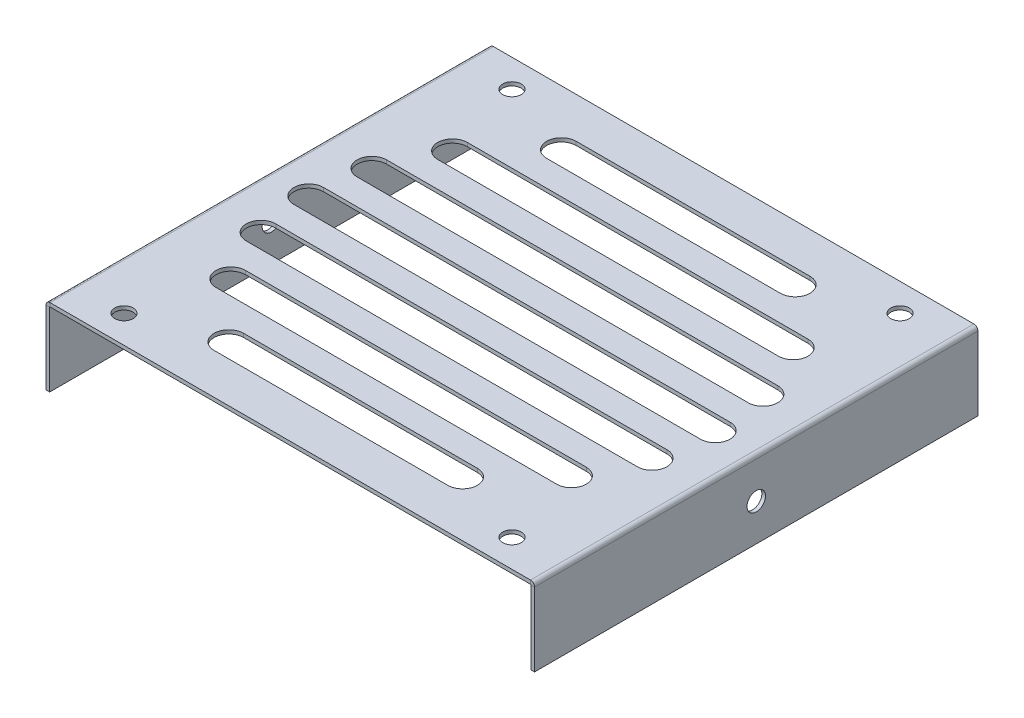
from build123d import *

# Parameters (mm, degrees)
SKETCH1_W               = 130
SKETCH1_H               = 120
SKETCH1_R               = 2.5
BOSS_EXTRUDE1_DEPTH     = 1
EDGE_FLANGE1_DEPTH      = 120
CUT_EXTRUDE1_DEPTH      = 92.48338647
CUT_EXTRUDE1_DEPTH_BACK = 92.48338647
SKETCH10_R              = 2.5


# Sheet-metal steps are written as plain solids
with BuildPart() as part:
    # Sketch1 → Boss-Extrude1 (new body)
    with BuildSketch(Plane(origin=(0, 0, 0), x_dir=(1, 0, 0), z_dir=(0, 1, 0))):
        Rectangle(SKETCH1_W, SKETCH1_H)
        with Locations(Location((-52.5, 52.5, 0), (0, 0, 270))):
            Circle(SKETCH1_R, mode=Mode.SUBTRACT)
        with Locations(Location((52.5, 52.5, 0), (0, 0, 90))):
            Circle(SKETCH1_R, mode=Mode.SUBTRACT)
        with Locations(Location((52.5, -52.5, 0), (0, 0, 270))):
            Circle(SKETCH1_R, mode=Mode.SUBTRACT)
        with Locations(Location((-52.5, -52.5, 0), (0, 0, 90))):
            Circle(SKETCH1_R, mode=Mode.SUBTRACT)
        with BuildLine():
            Line((-31.622776602, 49), (31.622776602, 49))
            ThreePointArc((31.622776602, 49), (35.622776602, 45), (31.622776602, 41))
            Line((31.622776602, 41), (-31.622776602, 41))
            ThreePointArc((-31.622776602, 41), (-35.622776602, 45), (-31.622776602, 49))
        make_face(mode=Mode.SUBTRACT)
        with BuildLine():
            Line((-46.097722286, 34), (46.097722286, 34))
            ThreePointArc((46.097722286, 34), (50.097722286, 30), (46.097722286, 26))
            Line((46.097722286, 26), (-46.097722286, 26))
            ThreePointArc((-46.097722286, 26), (-50.097722286, 30), (-46.097722286, 34))
        make_face(mode=Mode.SUBTRACT)
        with BuildLine():
            Line((-52.915026221, 19), (52.915026221, 19))
            ThreePointArc((52.915026221, 19), (56.915026221, 15), (52.915026221, 11))
            Line((52.915026221, 11), (-52.915026221, 11))
            ThreePointArc((-52.915026221, 11), (-56.915026221, 15), (-52.915026221, 19))
        make_face(mode=Mode.SUBTRACT)
        with BuildLine():
            Line((-55, 4), (55, 4))
            ThreePointArc((55, 4), (59, 0), (55, -4))
            Line((55, -4), (-55, -4))
            ThreePointArc((-55, -4), (-59, 0), (-55, 4))
        make_face(mode=Mode.SUBTRACT)
        with BuildLine():
            Line((-52.915026221, -19), (52.915026221, -19))
            ThreePointArc((52.915026221, -19), (56.915026221, -15), (52.915026221, -11))
            Line((52.915026221, -11), (-52.915026221, -11))
            ThreePointArc((-52.915026221, -11), (-56.915026221, -15), (-52.915026221, -19))
        make_face(mode=Mode.SUBTRACT)
        with BuildLine():
            Line((-46.097722286, -34), (46.097722286, -34))
            ThreePointArc((46.097722286, -34), (50.097722286, -30), (46.097722286, -26))
            Line((46.097722286, -26), (-46.097722286, -26))
            ThreePointArc((-46.097722286, -26), (-50.097722286, -30), (-46.097722286, -34))
        make_face(mode=Mode.SUBTRACT)
        with BuildLine():
            Line((-31.622776602, -49), (31.622776602, -49))
            ThreePointArc((31.622776602, -49), (35.622776602, -45), (31.622776602, -41))
            Line((31.622776602, -41), (-31.622776602, -41))
            ThreePointArc((-31.622776602, -41), (-35.622776602, -45), (-31.622776602, -49))
        make_face(mode=Mode.SUBTRACT)
    extrude(amount=BOSS_EXTRUDE1_DEPTH)

    # Edge-Flange1 section (across the edge) → Edge-Flange1 (add)
    with BuildSketch(Plane(origin=(-65.1, 0, 60), x_dir=(1, 0, 0), z_dir=(0, 0, -1))):
        with BuildLine():
            Line((-1, 0.1), (-1, 20))
            Line((-1, 20), (0, 20))
            Line((0, 20), (0, 0.1))
            ThreePointArc((0, 0.1), (0.029289322, 0.029289322), (0.1, 0))
            Line((0.1, 0), (0.1, -1))
            ThreePointArc((0.1, -1), (-0.677817459, -0.677817459), (-1, 0.1))
        make_face()
    edge_flange1 = extrude(amount=EDGE_FLANGE1_DEPTH)

    # Mirror1: Edge-Flange1 across plane
    add(edge_flange1.mirror(Plane(origin=(0, 0, 0), x_dir=(0, 0, 1), z_dir=(1, 0, 0))))

    # Sketch10 → Cut-Extrude1 (cut, two sides: drawn at the far end of the back side and taken through both)
    with BuildSketch(Plane(origin=(0, 0, 0), x_dir=(0, 0, -1), z_dir=(1, 0, 0)).offset(-CUT_EXTRUDE1_DEPTH_BACK)):
        with Locations((0, -10)):
            Circle(SKETCH10_R)
    extrude(amount=CUT_EXTRUDE1_DEPTH + CUT_EXTRUDE1_DEPTH_BACK, mode=Mode.SUBTRACT)


solid = part.part
